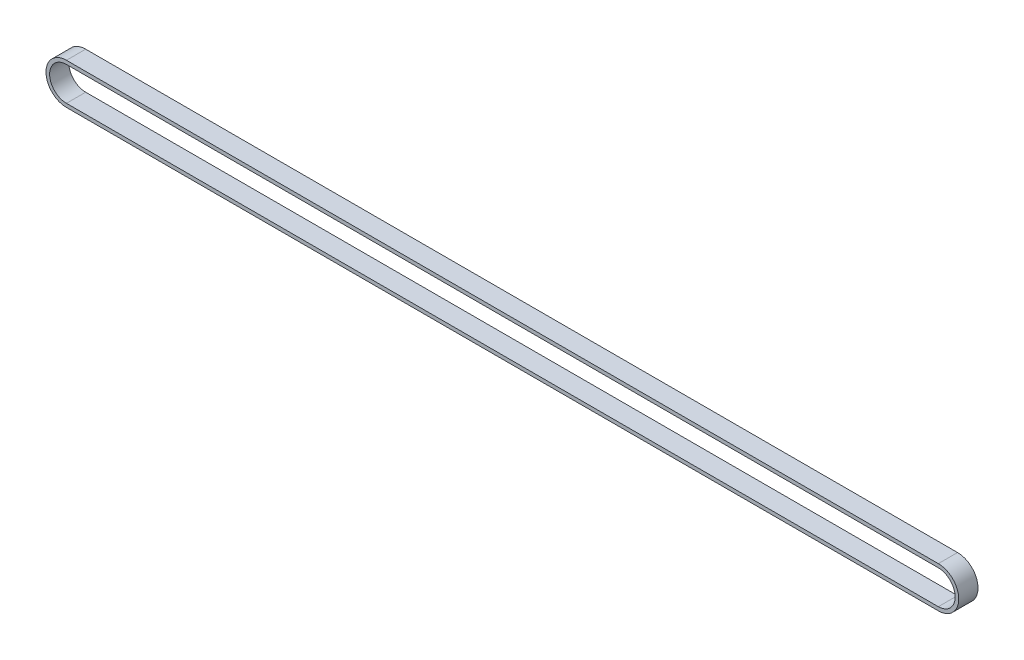
from build123d import *

# Parameters (mm, degrees)
ESTRUSIONE_ESTRUSIONE1_DEPTH = 6.4


with BuildPart() as part:
    # Schizzo1 → Estrusione-Estrusione1 (new body)
    with BuildSketch(Plane.XY):
        with BuildLine():
            Line((0, -6.8), (-290, -6.8))
            ThreePointArc((-290, -6.8), (-296.8, 0), (-290, 6.8))
            Line((-290, 6.8), (0, 6.8))
            ThreePointArc((0, 6.8), (6.8, 0), (0, -6.8))
        make_face()
        with BuildLine():
            Line((0, -5.6), (-290, -5.6))
            ThreePointArc((-290, -5.6), (-295.6, 0), (-290, 5.6))
            Line((-290, 5.6), (0, 5.6))
            ThreePointArc((0, 5.6), (5.6, 0), (0, -5.6))
        make_face(mode=Mode.SUBTRACT)
    extrude(amount=ESTRUSIONE_ESTRUSIONE1_DEPTH)


solid = part.part
